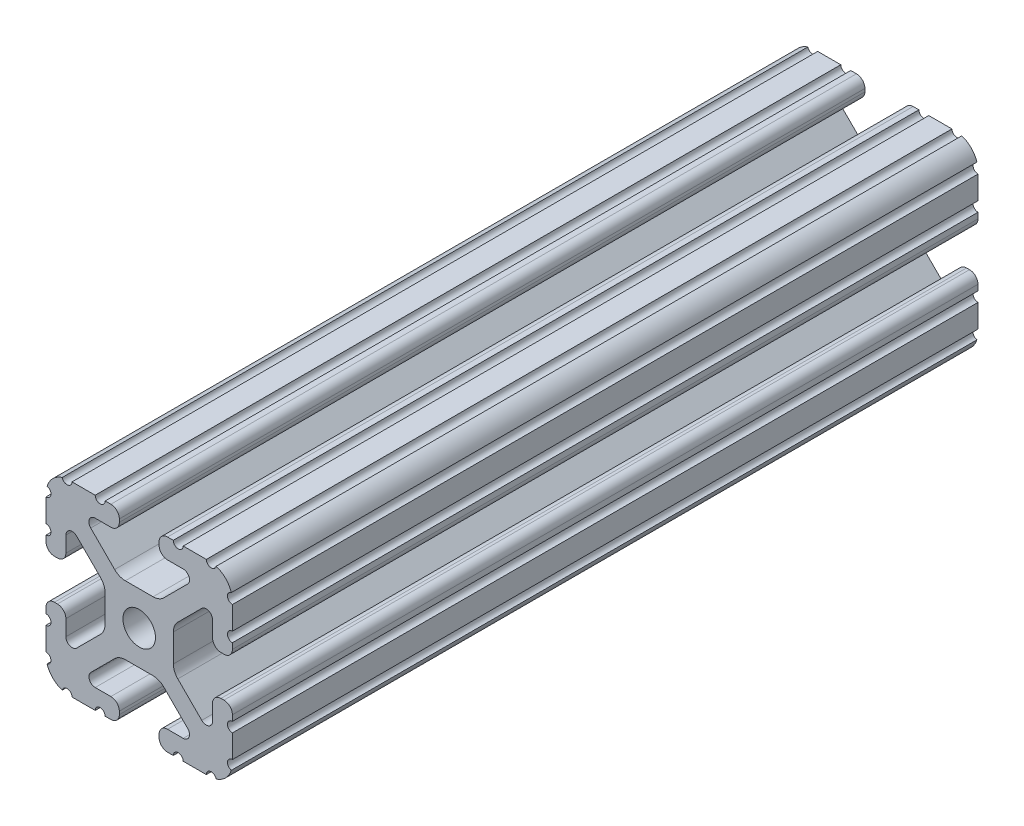
from build123d import *

# Parameters (mm, degrees)
BOSS_EXTRUDE1_DEPTH     = 76.2
CUT_EXTRUDE1_DEPTH      = 81.82230509
CUT_EXTRUDE1_DEPTH_BACK = 81.82230509
SKETCH5_R               = 1.016


with BuildPart() as part:
    # Sketch4 → Boss-Extrude1 (new, symmetric)
    with BuildSketch(Plane.XY):
        with BuildLine():
            Line((5.7912, -19.05), (14.3002, -19.05))
            ThreePointArc((14.3002, -19.05), (17.658815789, -17.658815789), (19.05, -14.3002))
            Line((19.05, -14.3002), (19.05, -5.7912))
            ThreePointArc((19.05, -5.7912), (18.544114832, -4.569885168), (17.3228, -4.064))
            Line((17.3228, -4.064), (16.7132, -4.064))
            ThreePointArc((16.7132, -4.064), (15.491885168, -4.569885168), (14.986, -5.7912))
            Line((14.986, -5.7912), (14.986, -8.996305235))
            ThreePointArc((14.986, -8.996305235), (14.189232738, -10.188751711), (12.782646215, -9.908964256))
            Line((12.782646215, -9.908964256), (7.888897763, -5.015215804))
            ThreePointArc((7.888897763, -5.015215804), (7.219915375, -4.014012907), (6.985, -2.833013566))
            Line((6.985, -2.833013566), (6.985, 0))
            Line((6.985, 0), (3.3274, 0))
            ThreePointArc((3.3274, 0), (2.352827104, -2.352827104), (0, -3.3274))
            Line((0, -3.3274), (0, -6.985))
            Line((0, -6.985), (2.833013566, -6.985))
            ThreePointArc((2.833013566, -6.985), (4.014012907, -7.219915375), (5.015215804, -7.888897763))
            Line((5.015215804, -7.888897763), (9.908964256, -12.782646215))
            ThreePointArc((9.908964256, -12.782646215), (10.188751711, -14.189232738), (8.996305235, -14.986))
            Line((8.996305235, -14.986), (5.7912, -14.986))
            ThreePointArc((5.7912, -14.986), (4.569885168, -15.491885168), (4.064, -16.7132))
            Line((4.064, -16.7132), (4.064, -17.3228))
            ThreePointArc((4.064, -17.3228), (4.569885168, -18.544114832), (5.7912, -19.05))
        make_face()
    extrude(amount=BOSS_EXTRUDE1_DEPTH, both=True)

    # Sketch5 → Cut-Extrude1 (cut, two sides: drawn at the far end of the back side and taken through both)
    with BuildSketch(Plane.XY.offset(-CUT_EXTRUDE1_DEPTH_BACK)):
        with Locations((14.739477062, -19.05)):
            Circle(SKETCH5_R)
        with Locations((7.980305235, -19.05)):
            Circle(SKETCH5_R)
        with Locations((19.05, -14.739477062)):
            Circle(SKETCH5_R)
        with Locations((19.05, -7.980305235)):
            Circle(SKETCH5_R)
    extrude(amount=CUT_EXTRUDE1_DEPTH + CUT_EXTRUDE1_DEPTH_BACK, mode=Mode.SUBTRACT)

    # Mirror1: part across plane


with BuildPart() as part_1:
    add(part.part)
    add(part.part.mirror(Plane(origin=(0, 0, 0), x_dir=(0, 0, 1), z_dir=(1, 0, 0))))

    # Mirror2: part across plane


with BuildPart() as part_2:
    add(part_1.part)
    add(part_1.part.mirror(Plane.ZX))


solid = part_2.part
